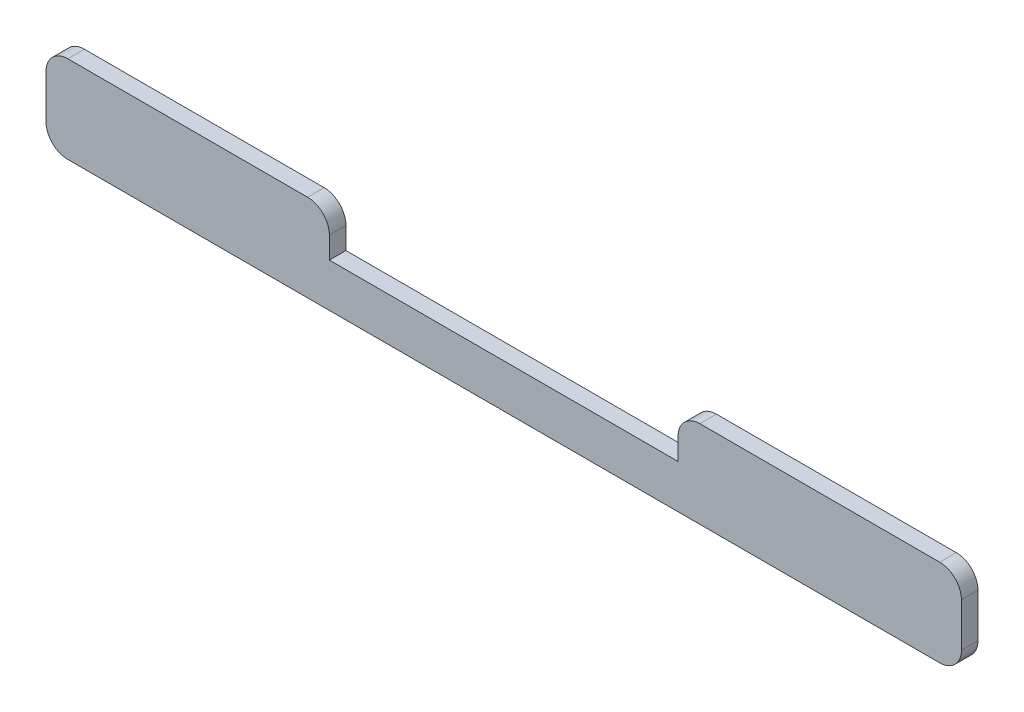
from build123d import *

# Parameters (mm, degrees)
BOSS_EXTRUDE1_DEPTH = 4.826


with BuildPart() as part:
    # Sketch1 → Boss-Extrude1 (new body)
    with BuildSketch(Plane.XY):
        with BuildLine():
            ThreePointArc((0, 6.35), (1.859871939, 1.859871939), (6.35, 0))
            Line((6.35, 0), (260.35, 0))
            ThreePointArc((260.35, 0), (264.840128061, 1.859871939), (266.7, 6.35))
            Line((266.7, 6.35), (266.7, 19.05))
            ThreePointArc((266.7, 19.05), (264.840128061, 23.540128061), (260.35, 25.4))
            Line((260.35, 25.4), (190.5, 25.4))
            ThreePointArc((190.5, 25.4), (186.009871939, 23.540128061), (184.15, 19.05))
            Line((184.15, 19.05), (184.15, 12.7))
            Line((184.15, 12.7), (82.55, 12.7))
            Line((82.55, 12.7), (82.55, 19.05))
            ThreePointArc((82.55, 19.05), (80.690128061, 23.540128061), (76.2, 25.4))
            Line((76.2, 25.4), (6.35, 25.4))
            ThreePointArc((6.35, 25.4), (1.859871939, 23.540128061), (0, 19.05))
            Line((0, 19.05), (0, 6.35))
        make_face()
    extrude(amount=BOSS_EXTRUDE1_DEPTH)


solid = part.part
